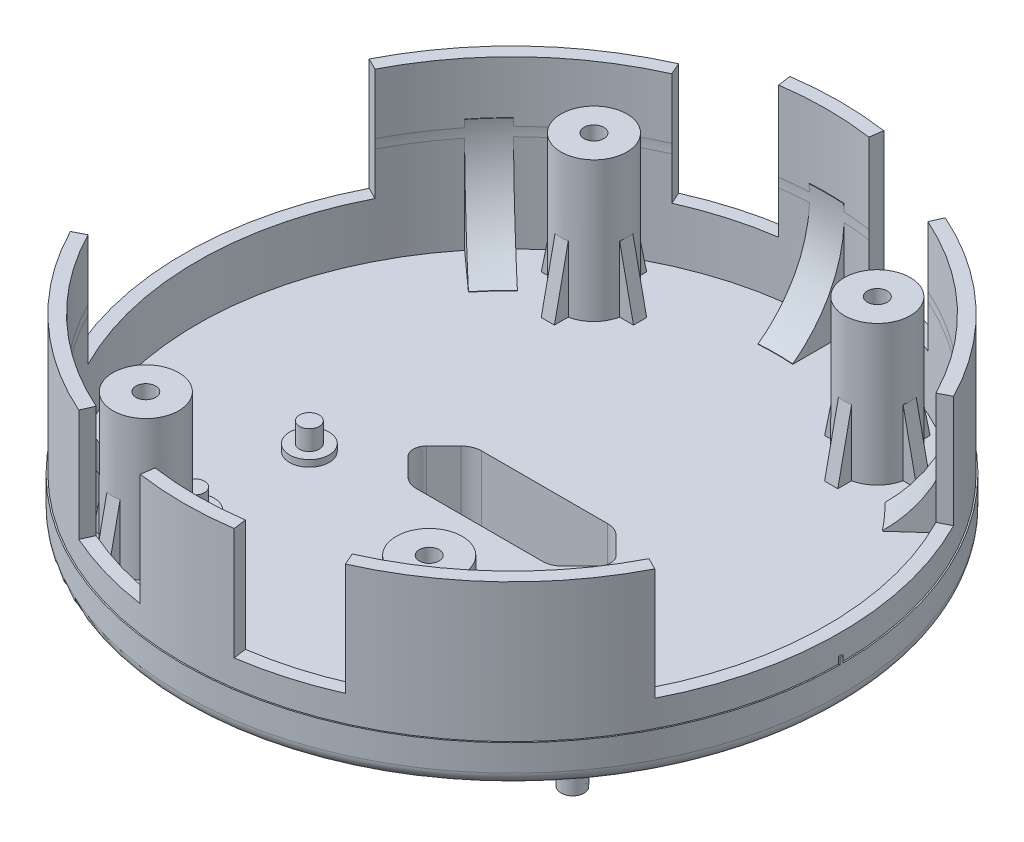
from build123d import *
from build123d.topology import SkipClean

# Parameters (mm, degrees)
SKETCH_1_R           = 50
EXTRUDE_1_DEPTH      = 6
SHELL_1_T            = -2
SKETCH_3_R           = 48
EXTRUDE_2_DEPTH      = 2
FILLET_1_R           = 2
SKETCH_4_R           = 49.8
SKETCH_4_R_2         = 47.8
EXTRUDE_3_DEPTH      = 23
EXTRUDE_4_DEPTH      = 20
CUT_EXTRUDE_3_DEPTH  = 22.5
SKETCH_10_R          = 3.5
EXTRUDE_5_DEPTH      = 6
SKETCH_15_R          = 50
SKETCH_15_R_2        = 48
EXTRUDE_9_DEPTH      = 2
EXTRUDE_10_DEPTH     = 15
EXTRUDE_14_DEPTH     = 1
CHAMFER_1_SIZE       = 0.200040458
CHAMFER_1_SIZE_2     = 0.2
CUT_EXTRUDE_START    = -2.253815501
CUT_EXTRUDE_11_DEPTH = 2.253815501
CUT_EXTRUDE_START_2  = -17
CUT_EXTRUDE_12_DEPTH = 17
SKETCH_36_R          = 1.5
EXTRUDE_15_DEPTH     = 4
SKETCH_44_R          = 3
EXTRUDE_17_DEPTH     = 1
SKETCH_47_R          = 5
EXTRUDE_18_DEPTH     = 21.25
SKETCH_48_R          = 1.5
CUT_EXTRUDE_20_DEPTH = 22.996184499
SKETCH_50_R          = 3.1
CUT_EXTRUDE_21_DEPTH = 19
SKETCH_51_W          = 20
SKETCH_51_H          = 15
CUT_EXTRUDE_22_DEPTH = 0.1
EXTRUDE_19_DEPTH     = 10
CUT_EXTRUDE_23_DEPTH = 2
CUT_EXTRUDE_25_DEPTH = 2
CUT_EXTRUDE_26_DEPTH = 2
CUT_EXTRUDE_27_DEPTH = 2
EXTRUDE_21_DEPTH     = 3


with BuildPart() as part:
    # Эскиз1 → Бобышка-Вытянуть1 (new body)
    with BuildSketch(Plane(origin=(0, 0, 0), x_dir=(1, 0, 0), z_dir=(0, 1, 0))):
        with Locations(Location((0, 0, 0), (0, 0, 270))):
            Circle(SKETCH_1_R)
    extrude(amount=EXTRUDE_1_DEPTH)

    # Оболочка1
    shell_1_openings = [part.faces().sort_by_distance(p)[0] for p in [
        (0, 6, 0),
    ]]
    offset(amount=SHELL_1_T, openings=shell_1_openings, kind=Kind.INTERSECTION)

    # Эскиз3 → Бобышка-Вытянуть2 (add)
    with BuildSketch(Plane(origin=(0, 2, 0), x_dir=(1, 0, 0), z_dir=(0, 1, 0))):
        with Locations(Location((0, 0, 0), (0, 0, 270))):
            Circle(SKETCH_3_R)
    extrude(amount=EXTRUDE_2_DEPTH)

    # Скругление1
    fillet_1_edges = [part.edges().sort_by_distance(p)[0] for p in [
        (0, 0, -50),
    ]]
    fillet(fillet_1_edges, radius=FILLET_1_R)

    # Эскиз4 → Бобышка-Вытянуть3 (add)
    with BuildSketch(Plane(origin=(0, 4, 0), x_dir=(1, 0, 0), z_dir=(0, 1, 0))):
        with Locations(Location((0, 0, 0), (0, 0, 270))):
            Circle(SKETCH_4_R)
        with Locations(Location((0, 0, 0), (0, 0, 270))):
            Circle(SKETCH_4_R_2, mode=Mode.SUBTRACT)
    extrude(amount=EXTRUDE_3_DEPTH)

    # Эскиз8 → Бобышка-Вытянуть4 (add)
    with BuildSketch(Plane.XZ):
        with BuildLine():
            Line((-17.136040826, 1.486040826), (-13.164720483, 5.45736117))
            ThreePointArc((-13.164720483, 5.45736117), (-11.50964911, 6.563244505), (-9.557359313, 6.951579091))
            Line((-9.557359313, 6.951579091), (9.557359313, 6.951579091))
            ThreePointArc((9.557359313, 6.951579091), (11.50964911, 6.563244505), (13.164720483, 5.45736117))
            Line((13.164720483, 5.45736117), (17.136040826, 1.486040826))
            ThreePointArc((17.136040826, 1.486040826), (17.751579091, 0), (17.136040826, -1.486040826))
            Line((17.136040826, -1.486040826), (13.164720483, -5.45736117))
            ThreePointArc((13.164720483, -5.45736117), (11.50964911, -6.563244505), (9.557359313, -6.951579091))
            Line((9.557359313, -6.951579091), (-9.557359313, -6.951579091))
            ThreePointArc((-9.557359313, -6.951579091), (-11.50964911, -6.563244505), (-13.164720483, -5.45736117))
            Line((-13.164720483, -5.45736117), (-17.136040826, -1.486040826))
            ThreePointArc((-17.136040826, -1.486040826), (-17.751579091, 0), (-17.136040826, 1.486040826))
        make_face()
    extrude(amount=EXTRUDE_4_DEPTH)

    # Эскиз9 → Вырез-Вытянуть3 (cut)
    with BuildSketch(Plane(origin=(0, 4, 0), x_dir=(1, 0, 0), z_dir=(0, 1, 0))):
        with BuildLine():
            Line((-14.380302466, 1.413352062), (-11.75050692, 4.043147607))
            ThreePointArc((-11.75050692, 4.043147607), (-10.744282245, 4.71548544), (-9.557359313, 4.951579091))
            Line((-9.557359313, 4.951579091), (9.557359313, 4.951579091))
            ThreePointArc((9.557359313, 4.951579091), (10.744282245, 4.71548544), (11.75050692, 4.043147607))
            Line((11.75050692, 4.043147607), (14.380302466, 1.413352062))
            add(Edge.make_bspline(
                [(14.380302466, -1.413352062), (15.793654528, 0), (14.380302466, 1.413352062)],
                knots=[2.356803478, 2.356803478, 2.356803478, 3.926381829, 3.926381829, 3.926381829], degree=2, weights=[1, 0.707537269, 1]))
            Line((14.380302466, -1.413352062), (11.75050692, -4.043147607))
            ThreePointArc((11.75050692, -4.043147607), (10.744282245, -4.71548544), (9.557359313, -4.951579091))
            Line((9.557359313, -4.951579091), (-9.557359313, -4.951579091))
            ThreePointArc((-9.557359313, -4.951579091), (-10.744282245, -4.71548544), (-11.75050692, -4.043147607))
            Line((-11.75050692, -4.043147607), (-14.380302466, -1.413352062))
            add(Edge.make_bspline(
                [(-14.380302466, 1.413352062), (-15.793654528, 0), (-14.380302466, -1.413352062)],
                knots=[2.356803478, 2.356803478, 2.356803478, 3.926381829, 3.926381829, 3.926381829], degree=2, weights=[1, 0.707537269, 1]))
        make_face()
    extrude(amount=-CUT_EXTRUDE_3_DEPTH, mode=Mode.SUBTRACT)

    # Эскиз10 → Бобышка-Вытянуть5 (add)
    with BuildSketch(Plane(origin=(0, -18.5, 0), x_dir=(1, 0, 0), z_dir=(0, 1, 0))):
        with Locations(Location((-9.4, 0, 0), (0, 0, 270))):
            Circle(SKETCH_10_R)
        with Locations(Location((9.4, 0, 0), (0, 0, 270))):
            Circle(SKETCH_10_R)
    extrude(amount=EXTRUDE_5_DEPTH)

    # Эскиз15 → Бобышка-Вытянуть9 (add)
    with BuildSketch(Plane(origin=(0, 4, 0), x_dir=(1, 0, 0), z_dir=(0, 1, 0))):
        with Locations(Location((0, 0, 0), (0, 0, 270))):
            Circle(SKETCH_15_R)
        Circle(SKETCH_15_R_2, mode=Mode.SUBTRACT)
    extrude(amount=EXTRUDE_9_DEPTH)

    # Эскиз16 → Бобышка-Вытянуть10 (add)
    with BuildSketch(Plane(origin=(0, 4, 0), x_dir=(1, 0, 0), z_dir=(0, 1, 0))):
        with BuildLine():
            ThreePointArc((-33.679961224, 33.919024337), (-35.493850062, 32.016036728), (-37.200371348, 30.016201818))
            Line((-37.200371348, 30.016201818), (-31.403949409, 24.797080063))
            ThreePointArc((-31.403949409, 24.797080063), (-29.707545595, 26.806061868), (-27.882860329, 28.699291246))
            Line((-27.882860329, 28.699291246), (-33.679961224, 33.919024337))
        make_face()
        with BuildLine():
            ThreePointArc((2.670454545, 47.725346227), (0.042530612, 47.799981079), (-2.585521975, 47.730022796))
            Line((-2.585521975, 47.730022796), (-2.585521975, 39.930167721))
            ThreePointArc((-2.585521975, 39.930167721), (0.042558171, 40.013765218), (2.670454545, 39.924577526))
            Line((2.670454545, 39.924577526), (2.670454545, 47.725346227))
        make_face()
        with BuildLine():
            ThreePointArc((37.200371348, 30.016201818), (35.493850062, 32.016036728), (33.679961224, 33.919024337))
            Line((33.679961224, 33.919024337), (27.882860329, 28.699291246))
            ThreePointArc((27.882860329, 28.699291246), (29.707545595, 26.806061868), (31.403949409, 24.797080063))
            Line((31.403949409, 24.797080063), (37.200371348, 30.016201818))
        make_face()
        with BuildLine():
            ThreePointArc((33.679961224, -33.919024337), (35.493850062, -32.016036728), (37.200371348, -30.016201818))
            Line((37.200371348, -30.016201818), (31.403949409, -24.797080063))
            ThreePointArc((31.403949409, -24.797080063), (29.707545595, -26.806061868), (27.882860329, -28.699291246))
            Line((27.882860329, -28.699291246), (33.679961224, -33.919024337))
        make_face()
        with BuildLine():
            ThreePointArc((-2.585521975, -47.730022796), (0.042530612, -47.799981079), (2.670454545, -47.725346227))
            Line((2.670454545, -47.725346227), (2.670454545, -39.924577526))
            ThreePointArc((2.670454545, -39.924577526), (0.042558171, -40.013765218), (-2.585521975, -39.930167721))
            Line((-2.585521975, -39.930167721), (-2.585521975, -47.730022796))
        make_face()
        with BuildLine():
            ThreePointArc((-37.200371348, -30.016201818), (-35.493850062, -32.016036728), (-33.679961224, -33.919024337))
            Line((-33.679961224, -33.919024337), (-27.882860329, -28.699291246))
            ThreePointArc((-27.882860329, -28.699291246), (-29.707545595, -26.806061868), (-31.403949409, -24.797080063))
            Line((-31.403949409, -24.797080063), (-37.200371348, -30.016201818))
        make_face()
    extrude(amount=EXTRUDE_10_DEPTH)

    # Эскиз27 → Бобышка-Вытянуть14 (add)
    with SkipClean():  # the faces are left unmerged after this step: merging them gives an invalid solid
        with BuildSketch(Plane(origin=(0, 6, 0), x_dir=(1, 0, 0), z_dir=(0, 1, 0))):
            with BuildLine():
                Line((49.999354421, -0.254081633), (49.799351828, -0.254081633))
                ThreePointArc((49.799351828, -0.254081633), (49.8, 0), (49.799351828, 0.254081633))
                Line((49.799351828, 0.254081633), (49.999354421, 0.254081633))
                ThreePointArc((49.999354421, 0.254081633), (50, 0), (49.999354421, -0.254081633))
            make_face()
            with BuildLine():
                Line((-49.999354421, 0.254081633), (-49.799351828, 0.254081633))
                ThreePointArc((-49.799351828, 0.254081633), (-49.8, 0), (-49.799351828, -0.254081633))
                Line((-49.799351828, -0.254081633), (-49.999354421, -0.254081633))
                ThreePointArc((-49.999354421, -0.254081633), (-50, 0), (-49.999354421, 0.254081633))
            make_face()
        extrude(amount=EXTRUDE_14_DEPTH)

    # Эскиз29 → Повернуть4 (revolve)
    with SkipClean():  # the faces are left unmerged after this step: merging them gives an invalid solid
        with BuildSketch(Plane.XY):
            Polygon((7.572856904, -23.460328592), (7.416740071, -30.458587485), (9.1671853, -30.497175812), (9.235929753, -27.398280459), (9.322426467, -23.49914023), (9.408923181, -19.6), (7.458923181, -19.6), (7.372905482, -23.45592069), align=None)
        revolve(axis=Axis((9.408923181, -19.6, 0), (-0.02217807872875682, -0.999754036162846, 0)))

    # Эскиз30 → Повернуть5 (revolve)
    with SkipClean():  # the faces are left unmerged after this step: merging them gives an invalid solid
        with BuildSketch(Plane.XY):
            Polygon((-9.407626859, -19.599999992), (-9.32160916, -23.455920682), (-9.235112446, -27.355060912), (-9.166310171, -30.456562748), (-10.915927332, -30.493228144), (-11.071173883, -23.494949891), (-11.271130145, -23.499140222), (-11.357626859, -19.599999992), align=None)
        revolve(axis=Axis((-9.407626859, -19.599999992, 0), (0.022302404777600288, -0.9997512704373704, 0)))

    # Эскиз32 → Вырез-Повернуть2 (revolve, cut)
    with SkipClean():  # the faces are left unmerged after this step: merging them gives an invalid solid
        with BuildSketch(Plane.XY):
            Polygon((7.967475099, -30.470804735), (8.21586958, -19.27355953), (8.31584543, -19.27575712), (8.49327006, -11.27772483), (9.593004411, -11.301898317), (9.1671853, -30.497175812), align=None)
        revolve(axis=Axis((9.593004411, -11.301898317, 0), (-0.022178078728756517, -0.999754036162846, 0)), mode=Mode.SUBTRACT)

    # Эскиз33 → Вырез-Повернуть3 (revolve, cut)
    with SkipClean():  # the faces are left unmerged after this step: merging them gives an invalid solid
        with BuildSketch(Plane.XY, mode=Mode.PRIVATE) as cut_revolve_3_sk:
            Polygon((-9.591260274, -11.261487921), (-9.165441162, -30.456765416), (-7.965730961, -30.430394339), (-8.214125443, -19.233149134), (-8.314101293, -19.235346723), (-8.491525923, -11.237314434), align=None)
        revolve(cut_revolve_3_sk.sketch.rotate(Axis((-9.591260274, -11.261487921, 0), (0.022178078728757145, -0.999754036162846, 0)), 180), axis=Axis((-9.591260274, -11.261487921, 0), (0.022178078728757145, -0.999754036162846, 0)), mode=Mode.SUBTRACT)

    # Фаска1
    # the kernel refuses this chamfer: 0.200040458, 0.2 mm, written as the material it takes off along each edge
    with BuildSketch(Plane(origin=(9.415574848, -19.300153006, 0), x_dir=(-0.9997540361628459, 0.022178078728756406, 0), z_dir=(0, 0, 1))) as chamfer_1_piece_1_section:
        Polygon((1.099999978, -CHAMFER_1_SIZE * 1.000000002), (1.099999978 + CHAMFER_1_SIZE_2 * 0.999999979551, CHAMFER_1_SIZE_2 * 0.000202230633333), (1.099999978, 0), align=None)
    chamfer_1_piece_1 = revolve(axis=Axis((9.415574848, -19.300153006, 0), (-0.022178078728756517, -0.999754036162846, 0)), mode=Mode.PRIVATE)
    chamfer_1_piece_1 = chamfer_1_piece_1 & Plane(origin=(9.418887994, -19.15080142, 0), x_dir=(-0.999754036162846, 0.022178078728756517, 0), z_dir=(0.022178078728756517, 0.999754036162846, 0)) * Cylinder(1.199999975, 6, mode=Mode.PRIVATE)
    add(chamfer_1_piece_1, mode=Mode.SUBTRACT)
    with BuildSketch(Plane(origin=(-9.41383071, -19.25974261, 0), x_dir=(-0.9997540361628459, -0.022178078728756406, 0), z_dir=(0, 0, 1))) as chamfer_1_piece_2_section:
        Polygon((1.099999978, -CHAMFER_1_SIZE * 1.000000002), (1.099999978 + CHAMFER_1_SIZE_2 * 0.999999979551, CHAMFER_1_SIZE_2 * 0.000202230633302), (1.099999978, 0), align=None)
    chamfer_1_piece_2 = revolve(axis=Axis((-9.41383071, -19.25974261, 0), (0.022178078728757145, -0.999754036162846, 0)), mode=Mode.PRIVATE)
    chamfer_1_piece_2 = chamfer_1_piece_2 & Plane(origin=(-9.417143856, -19.110391024, 0), x_dir=(-0.999754036162846, -0.022178078728757145, 0), z_dir=(-0.022178078728757145, 0.999754036162846, 0)) * Cylinder(1.199999975, 6, mode=Mode.PRIVATE)
    add(chamfer_1_piece_2, mode=Mode.SUBTRACT)

    # Эскиз28 → Вырез-Вытянуть11 (cut)
    with BuildSketch(Plane(origin=(0, 4, 0), x_dir=(1, 0, 0), z_dir=(0, 1, 0)).offset(CUT_EXTRUDE_START)):
        with BuildLine():
            Line((-37.200371348, 30.016201818), (-31.403949409, 24.797080063))
            ThreePointArc((-31.403949409, 24.797080063), (-29.707545595, 26.806061868), (-27.882860329, 28.699291246))
            Line((-27.882860329, 28.699291246), (-33.679961224, 33.919024337))
            ThreePointArc((-33.679961224, 33.919024337), (-19.403150196, 43.684754348), (-2.585521975, 47.730022796))
            Line((-2.585521975, 47.730022796), (-2.585521975, 39.930167721))
            ThreePointArc((-2.585521975, 39.930167721), (0.042558171, 40.013765218), (2.670454545, 39.924577526))
            Line((2.670454545, 39.924577526), (2.670454545, 47.725346227))
            ThreePointArc((2.670454545, 47.725346227), (19.442011539, 43.667472875), (33.679961224, 33.919024337))
            Line((33.679961224, 33.919024337), (27.882860329, 28.699291246))
            ThreePointArc((27.882860329, 28.699291246), (29.707545595, 26.806061868), (31.403949409, 24.797080063))
            Line((31.403949409, 24.797080063), (37.200371348, 30.016201818))
            ThreePointArc((37.200371348, 30.016201818), (47.8, 0), (37.200371348, -30.016201818))
            Line((37.200371348, -30.016201818), (31.403949409, -24.797080063))
            ThreePointArc((31.403949409, -24.797080063), (29.707545595, -26.806061868), (27.882860329, -28.699291246))
            Line((27.882860329, -28.699291246), (33.679961224, -33.919024337))
            ThreePointArc((33.679961224, -33.919024337), (19.442011539, -43.667472875), (2.670454545, -47.725346227))
            Line((2.670454545, -47.725346227), (2.670454545, -39.924577526))
            ThreePointArc((2.670454545, -39.924577526), (0.042558171, -40.013765218), (-2.585521975, -39.930167721))
            Line((-2.585521975, -39.930167721), (-2.585521975, -47.730022796))
            ThreePointArc((-2.585521975, -47.730022796), (-19.403150196, -43.684754348), (-33.679961224, -33.919024337))
            Line((-33.679961224, -33.919024337), (-27.882860329, -28.699291246))
            ThreePointArc((-27.882860329, -28.699291246), (-29.707545595, -26.806061868), (-31.403949409, -24.797080063))
            Line((-31.403949409, -24.797080063), (-37.200371348, -30.016201818))
            ThreePointArc((-37.200371348, -30.016201818), (-47.8, 0), (-37.200371348, 30.016201818))
        make_face()
    extrude(amount=CUT_EXTRUDE_11_DEPTH, mode=Mode.SUBTRACT)

    # Эскиз34 → Вырез-Вытянуть12 (cut)
    with BuildSketch(Plane(origin=(0, 27, 0), x_dir=(1, 0, 0), z_dir=(0, 1, 0)).offset(CUT_EXTRUDE_START_2)):
        with BuildLine():
            Line((-6.84384702, 47.30752327), (-7.130200452, 49.286917549))
            ThreePointArc((-7.130200452, 49.286917549), (-13.81233626, 47.846205357), (-20.234232966, 45.504019782))
            Line((-20.234232966, 45.504019782), (-19.421613168, 43.676549108))
            ThreePointArc((-19.421613168, 43.676549108), (-13.25762396, 45.924671005), (-6.84384702, 47.30752327))
        make_face()
        with BuildLine():
            Line((6.84384702, 47.30752327), (7.130200452, 49.286917549))
            ThreePointArc((7.130200452, 49.286917549), (13.81233626, 47.846205357), (20.234232966, 45.504019782))
            Line((20.234232966, 45.504019782), (19.421613168, 43.676549108))
            ThreePointArc((19.421613168, 43.676549108), (13.25762396, 45.924671005), (6.84384702, 47.30752327))
        make_face()
        with BuildLine():
            Line((6.84384702, -47.30752327), (7.130200452, -49.286917549))
            ThreePointArc((7.130200452, -49.286917549), (13.81233626, -47.846205357), (20.234232966, -45.504019782))
            Line((20.234232966, -45.504019782), (19.421613168, -43.676549108))
            ThreePointArc((19.421613168, -43.676549108), (13.25762396, -45.924671005), (6.84384702, -47.30752327))
        make_face()
        with BuildLine():
            Line((-6.84384702, -47.30752327), (-7.130200452, -49.286917549))
            ThreePointArc((-7.130200452, -49.286917549), (-13.81233626, -47.846205357), (-20.234232966, -45.504019782))
            Line((-20.234232966, -45.504019782), (-19.421613168, -43.676549108))
            ThreePointArc((-19.421613168, -43.676549108), (-13.25762396, -45.924671005), (-6.84384702, -47.30752327))
        make_face()
        with BuildLine():
            Line((-42.558124254, 21.763411037), (-44.338798909, 22.67401401))
            ThreePointArc((-44.338798909, 22.67401401), (-49.8, 0), (-44.338798909, -22.67401401))
            Line((-44.338798909, -22.67401401), (-42.558124254, -21.763411037))
            ThreePointArc((-42.558124254, -21.763411037), (-47.8, 0), (-42.558124254, 21.763411037))
        make_face()
        with BuildLine():
            Line((42.558124254, -21.763411037), (44.338798909, -22.67401401))
            ThreePointArc((44.338798909, -22.67401401), (49.8, 0), (44.338798909, 22.67401401))
            Line((44.338798909, 22.67401401), (42.558124254, 21.763411037))
            ThreePointArc((42.558124254, 21.763411037), (47.8, 0), (42.558124254, -21.763411037))
        make_face()
    extrude(amount=CUT_EXTRUDE_12_DEPTH, mode=Mode.SUBTRACT)

    # Эскиз36 → Бобышка-Вытянуть15 (add)
    with BuildSketch(Plane(origin=(0, 1.746184499, 0), x_dir=(1, 0, 0), z_dir=(0, 1, 0))):
        with Locations(Location((-22.6, -8.151579091, 0), (0, 0, 270))):
            Circle(SKETCH_36_R)
        with Locations(Location((22.6, -25.551579091, 0), (0, 0, 270))):
            Circle(SKETCH_36_R)
        with Locations(Location((22.6, -8.151579091, 0), (0, 0, 270))):
            Circle(SKETCH_36_R)
        with Locations(Location((-22.6, -25.551579091, 0), (0, 0, 270))):
            Circle(SKETCH_36_R)
    extrude(amount=EXTRUDE_15_DEPTH)

    # Эскиз44 → Бобышка-Вытянуть17 (add)
    with BuildSketch(Plane(origin=(0, 1.746184499, 0), x_dir=(1, 0, 0), z_dir=(0, 1, 0))):
        with Locations(Location((-22.6, -8.151579091, 0), (0, 0, 270))):
            Circle(SKETCH_44_R)
        with Locations(Location((22.6, -8.151579091, 0), (0, 0, 270))):
            Circle(SKETCH_44_R)
        with Locations(Location((-22.6, -25.551579091, 0), (0, 0, 270))):
            Circle(SKETCH_44_R)
        with Locations(Location((22.6, -25.551579091, 0), (0, 0, 270))):
            Circle(SKETCH_44_R)
    extrude(amount=EXTRUDE_17_DEPTH)

    # Эскиз45 → Вырез-Повернуть4 (revolve, cut)
    with BuildSketch(Plane(origin=(0, 0, 0), x_dir=(0, 0, -1), z_dir=(1, 0, 0)), mode=Mode.PRIVATE) as cut_revolve_4_sk:
        with BuildLine():
            Line((-47.725346227, 19), (-39.924577526, 19))
            Line((-39.924577526, 19), (-39.924577526, 1.746184499))
            ThreePointArc((-39.924577526, 1.746184499), (-46.121133942, 9.334950444), (-47.725346227, 19))
        make_face()
    revolve(cut_revolve_4_sk.sketch.rotate(Axis((0, 0, 0), (0, 1, 0)), 188.231711068), axis=Axis((0, 0, 0), (0, 1, 0)), mode=Mode.SUBTRACT)

    # Эскиз47 → Бобышка-Вытянуть18 (add)
    with BuildSketch(Plane(origin=(0, 1.746184499, 0), x_dir=(1, 0, 0), z_dir=(0, 1, 0))):
        with Locations(Location((21.435699383, 34, 0), (0, 0, 270))):
            Circle(SKETCH_47_R)
        with Locations(Location((-21.564300617, 34, 0), (0, 0, 270))):
            Circle(SKETCH_47_R)
        with Locations(Location((-21.564300617, -34, 0), (0, 0, 270))):
            Circle(SKETCH_47_R)
        with Locations(Location((21.435699383, -34, 0), (0, 0, 270))):
            Circle(SKETCH_47_R)
    extrude(amount=EXTRUDE_18_DEPTH)

    # Эскиз48 → Вырез-Вытянуть20 (cut)
    with BuildSketch(Plane(origin=(0, 22.996184499, 0), x_dir=(1, 0, 0), z_dir=(0, 1, 0))):
        with Locations(Location((-21.564300617, 34, 0), (0, 0, 270))):
            Circle(SKETCH_48_R)
        with Locations(Location((21.435699383, 34, 0), (0, 0, 270))):
            Circle(SKETCH_48_R)
        with Locations(Location((21.435699383, -34, 0), (0, 0, 270))):
            Circle(SKETCH_48_R)
        with Locations(Location((-21.564300617, -34, 0), (0, 0, 270))):
            Circle(SKETCH_48_R)
    extrude(amount=-CUT_EXTRUDE_20_DEPTH, mode=Mode.SUBTRACT)

    # Эскиз50 → Вырез-Вытянуть21 (cut)
    with BuildSketch(Plane.XZ):
        with Locations(Location((-21.564300617, 34, 0), (0, 0, 270))):
            Circle(SKETCH_50_R)
        with Locations(Location((21.435699383, 34, 0), (0, 0, 270))):
            Circle(SKETCH_50_R)
        with Locations(Location((21.435699383, -34, 0), (0, 0, 270))):
            Circle(SKETCH_50_R)
        with Locations(Location((-21.564300617, -34, 0), (0, 0, 270))):
            Circle(SKETCH_50_R)
    extrude(amount=-CUT_EXTRUDE_21_DEPTH, mode=Mode.SUBTRACT)

    # Эскиз51 → Вырез-Вытянуть22 (cut)
    with BuildSketch(Plane.XZ):
        with Locations((0, 27.5)):
            Rectangle(SKETCH_51_W, SKETCH_51_H)
    extrude(amount=-CUT_EXTRUDE_22_DEPTH, mode=Mode.SUBTRACT)

    # Эскиз58 → Бобышка-Вытянуть19 (add)
    with BuildSketch(Plane(origin=(0, 1.746184499, 0), x_dir=(1, 0, 0), z_dir=(0, 1, 0))):
        with BuildLine():
            Line((26.435699383, 35), (28.435699383, 35))
            Line((28.435699383, 35), (28.435699383, 33))
            Line((28.435699383, 33), (26.334678868, 33))
            ThreePointArc((26.334678868, 33), (26.435699383, 34), (26.334678868, 35))
            Line((26.334678868, 35), (26.435699383, 35))
        make_face()
        with BuildLine():
            Line((20.435699383, 39), (20.435699383, 41))
            Line((20.435699383, 41), (22.435699383, 41))
            Line((22.435699383, 41), (22.435699383, 38.898979486))
            ThreePointArc((22.435699383, 38.898979486), (21.435699383, 39), (20.435699383, 38.898979486))
            Line((20.435699383, 38.898979486), (20.435699383, 39))
        make_face()
        with BuildLine():
            Line((22.435699383, 29), (22.435699383, 27))
            Line((22.435699383, 27), (20.435699383, 27))
            Line((20.435699383, 27), (20.435699383, 29.101020514))
            ThreePointArc((20.435699383, 29.101020514), (21.435699383, 29), (22.435699383, 29.101020514))
            Line((22.435699383, 29.101020514), (22.435699383, 29))
        make_face()
        with BuildLine():
            Line((-26.564300617, 33), (-28.564300617, 33))
            Line((-28.564300617, 33), (-28.564300617, 35))
            Line((-28.564300617, 35), (-26.463280103, 35))
            ThreePointArc((-26.463280103, 35), (-26.564300617, 34), (-26.463280103, 33))
            Line((-26.463280103, 33), (-26.564300617, 33))
        make_face()
        with BuildLine():
            Line((-22.564300617, 39), (-22.564300617, 41))
            Line((-22.564300617, 41), (-20.564300617, 41))
            Line((-20.564300617, 41), (-20.564300617, 38.898979486))
            ThreePointArc((-20.564300617, 38.898979486), (-21.564300617, 39), (-22.564300617, 38.898979486))
            Line((-22.564300617, 38.898979486), (-22.564300617, 39))
        make_face()
        with BuildLine():
            Line((-16.564300617, 35), (-14.564300617, 35))
            Line((-14.564300617, 35), (-14.564300617, 33))
            Line((-14.564300617, 33), (-16.665321132, 33))
            ThreePointArc((-16.665321132, 33), (-16.564300617, 34), (-16.665321132, 35))
            Line((-16.665321132, 35), (-16.564300617, 35))
        make_face()
        with BuildLine():
            Line((-20.564300617, 29), (-20.564300617, 27))
            Line((-20.564300617, 27), (-22.564300617, 27))
            Line((-22.564300617, 27), (-22.564300617, 29.101020514))
            ThreePointArc((-22.564300617, 29.101020514), (-21.564300617, 29), (-20.564300617, 29.101020514))
            Line((-20.564300617, 29.101020514), (-20.564300617, 29))
        make_face()
        with BuildLine():
            Line((14.435699383, 33), (14.435699383, 35))
            Line((14.435699383, 35), (16.536719897, 35))
            ThreePointArc((16.536719897, 35), (16.435699383, 34), (16.536719897, 33))
            Line((16.536719897, 33), (16.435699383, 33))
            Line((16.435699383, 33), (14.435699383, 33))
        make_face()
        with BuildLine():
            Line((14.435699383, -33), (16.536719897, -33))
            ThreePointArc((16.536719897, -33), (16.435699383, -34), (16.536719897, -35))
            Line((16.536719897, -35), (16.435699383, -35))
            Line((16.435699383, -35), (14.435699383, -35))
            Line((14.435699383, -35), (14.435699383, -33))
        make_face()
        with BuildLine():
            Line((-14.564300617, -33), (-14.564300617, -35))
            Line((-14.564300617, -35), (-16.665321132, -35))
            ThreePointArc((-16.665321132, -35), (-16.564300617, -34), (-16.665321132, -33))
            Line((-16.665321132, -33), (-16.564300617, -33))
            Line((-16.564300617, -33), (-14.564300617, -33))
        make_face()
        with BuildLine():
            Line((-20.564300617, -39), (-20.564300617, -41))
            Line((-20.564300617, -41), (-22.564300617, -41))
            Line((-22.564300617, -41), (-22.564300617, -38.898979486))
            ThreePointArc((-22.564300617, -38.898979486), (-21.564300617, -39), (-20.564300617, -38.898979486))
            Line((-20.564300617, -38.898979486), (-20.564300617, -39))
        make_face()
        with BuildLine():
            Line((28.435699383, -33), (28.435699383, -35))
            Line((28.435699383, -35), (26.334678868, -35))
            ThreePointArc((26.334678868, -35), (26.435699383, -34), (26.334678868, -33))
            Line((26.334678868, -33), (26.435699383, -33))
            Line((26.435699383, -33), (28.435699383, -33))
        make_face()
        with BuildLine():
            Line((22.435699383, -39), (22.435699383, -41))
            Line((22.435699383, -41), (20.435699383, -41))
            Line((20.435699383, -41), (20.435699383, -38.898979486))
            ThreePointArc((20.435699383, -38.898979486), (21.435699383, -39), (22.435699383, -38.898979486))
            Line((22.435699383, -38.898979486), (22.435699383, -39))
        make_face()
        with BuildLine():
            Line((-26.564300617, -35), (-28.564300617, -35))
            Line((-28.564300617, -35), (-28.564300617, -33))
            Line((-28.564300617, -33), (-26.463280103, -33))
            ThreePointArc((-26.463280103, -33), (-26.564300617, -34), (-26.463280103, -35))
            Line((-26.463280103, -35), (-26.564300617, -35))
        make_face()
    extrude(amount=EXTRUDE_19_DEPTH)

    # Эскиз59 → Вырез-Вытянуть23 (cut)
    with BuildSketch(Plane.XY.offset(-33)):
        Polygon((-28.564300617, 11.746184499), (-26.463280103, 11.746184499), (-28.564300617, 1.746184499), align=None)
        Polygon((-16.665321132, 11.746184499), (-14.564300617, 11.746184499), (-14.564300617, 1.746184499), align=None)
        Polygon((14.435699383, 11.746184499), (16.536719897, 11.746184499), (14.435699383, 1.746184499), align=None)
        Polygon((26.334678868, 11.746184499), (28.435699383, 11.746184499), (28.435699383, 1.746184499), align=None)
    extrude(amount=-CUT_EXTRUDE_23_DEPTH, mode=Mode.SUBTRACT)

    # Эскиз60 → Вырез-Вытянуть25 (cut)
    with BuildSketch(Plane(origin=(-20.564300617, 0, 0), x_dir=(0, 0, -1), z_dir=(1, 0, 0))):
        Polygon((-41, 11.746184499), (-38.898979486, 11.746184499), (-41, 1.746184499), align=None)
        Polygon((27, 11.746184499), (29.101020514, 11.746184499), (27, 1.746184499), align=None)
        Polygon((38.898979486, 11.746184499), (41, 11.746184499), (41, 1.746184499), align=None)
    extrude(amount=-CUT_EXTRUDE_25_DEPTH, mode=Mode.SUBTRACT)

    # Эскиз61 → Вырез-Вытянуть26 (cut)
    with BuildSketch(Plane(origin=(0, 0, 33), x_dir=(-1, 0, 0), z_dir=(0, 0, -1))):
        Polygon((28.564300617, 11.746184499), (28.564300617, 1.746184499), (26.463280103, 11.746184499), align=None)
        Polygon((14.564300617, 11.746184499), (14.564300617, 1.746184499), (16.665321132, 11.746184499), align=None)
        Polygon((-28.435699383, 11.746184499), (-28.435699383, 1.746184499), (-26.334678868, 11.746184499), align=None)
        Polygon((-14.435699383, 11.746184499), (-14.435699383, 1.746184499), (-16.536719897, 11.746184499), align=None)
    extrude(amount=-CUT_EXTRUDE_26_DEPTH, mode=Mode.SUBTRACT)

    # Эскиз62 → Вырез-Вытянуть27 (cut)
    with BuildSketch(Plane.ZY.offset(-20.435699383)):
        Polygon((41, 11.746184499), (41, 1.746184499), (38.898979486, 11.746184499), align=None)
        Polygon((-41, 11.746184499), (-41, 1.746184499), (-38.898979486, 11.746184499), align=None)
        Polygon((-27, 11.746184499), (-27, 1.746184499), (-29.101020514, 11.746184499), align=None)
    extrude(amount=-CUT_EXTRUDE_27_DEPTH, mode=Mode.SUBTRACT)

    # Эскиз64 → Бобышка-Вытянуть21 (add)
    with BuildSketch(Plane(origin=(0, 27, 0), x_dir=(1, 0, 0), z_dir=(0, 1, 0))):
        with BuildLine():
            Line((7.130200452, 49.286917549), (6.84384702, 47.30752327))
            ThreePointArc((6.84384702, 47.30752327), (0, 47.8), (-6.84384702, 47.30752327))
            Line((-6.84384702, 47.30752327), (-7.130200452, 49.286917549))
            ThreePointArc((-7.130200452, 49.286917549), (0, 49.8), (7.130200452, 49.286917549))
        make_face()
    extrude(amount=EXTRUDE_21_DEPTH)


solid = part.part
